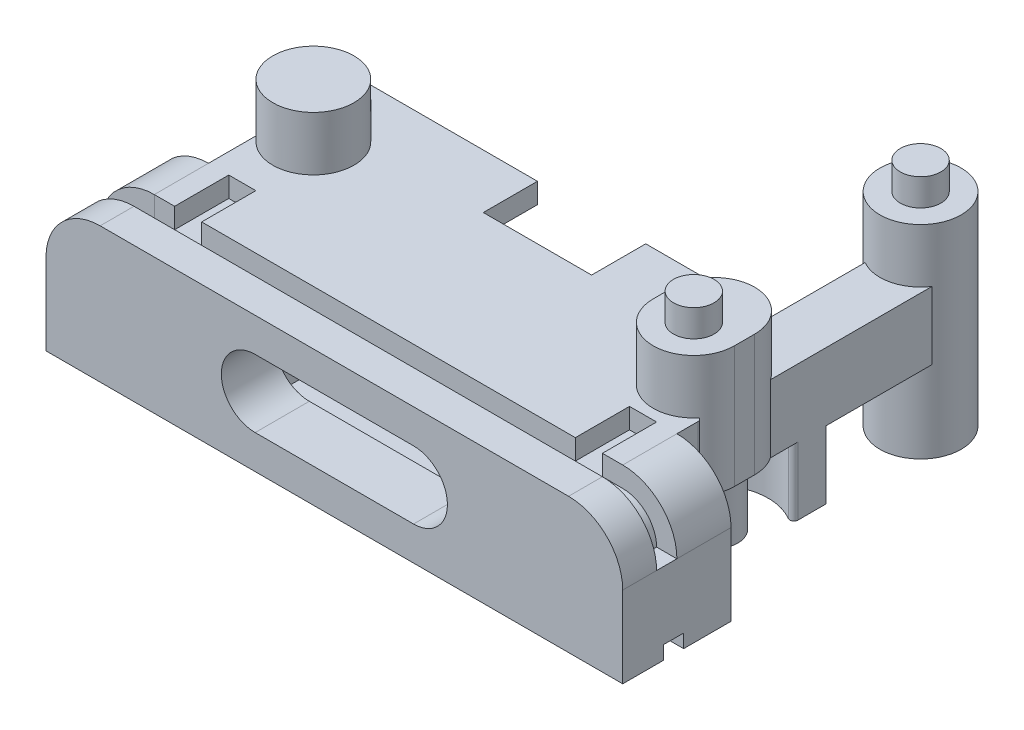
from build123d import *

# Parameters (mm, degrees)
SKETCH1_W                    = 21.3
SKETCH1_H                    = 4
FRONT_DEPTH                  = 5
FRONT_FILLET_R               = 2
TYPE_C_DEPTH                 = 4
TYPE_C_INSIDE_FILET_R        = 0.1
SKETCH15_W                   = 2
SKETCH15_H                   = 2.5
LEFT_BODY_DEPTH              = 9.65
SKETCH16_W                   = 2
SKETCH16_H                   = 2.5
RIGHT_BODY_DEPTH             = 5
SKETCH32_R                   = 1.5
POSTS_DEPTH                  = 2
POSTS_DIRECTION_2_REACH      = 25.913
SKETCH_44_W                  = 17.3
SKETCH_44_H                  = 5
BODY_DEPTH                   = 5.5
SKETCH56_R                   = 2
SKETCH56_R_2                 = 1.75
TOP_POSTS_CUT_DEPTH          = 2.5
SKETCH90_W                   = 6.623504636
SKETCH90_H                   = 1.75
TOP_SLOT_DEPTH               = 0.4
SKETCH37_R                   = 0.75
SKETCH37_R_2                 = 0.875
TOP_POSTS_DEPTH              = 2.5
SKETCH94_R                   = 1.5
TOP_POSTS_BACK_DEPTH         = 3
SKETCH38_R                   = 0.75
BOTTOM_POSTS_DEPTH           = 1
PCB_DEPTH                    = 2
PCB_DEPTH_BACK               = 5.5
SKETCH43_W                   = 10
SKETCH43_H                   = 0.9
SKETCH91_W                   = 8.5
SKETCH91_H                   = 1.3
PCB_TOP_BOTTOM_DEPTH         = 7.5
PCB_TOP_BOTTOM_FILLET_R      = 0.25
SKETCH95_W                   = 4
SKETCH95_H                   = 2
LATCH_DEPTH                  = 0.75
SKETCH83_W                   = 0.75
SKETCH83_H                   = 0.5
SKETCH89_W                   = 0.5
SKETCH89_H                   = 0.75
SKETCH86_W                   = 0.5
SKETCH86_H                   = 0.75
SKETCH75_W                   = 0.75
SKETCH75_H                   = 0.75
SKETCH93_W                   = 1
SKETCH93_H                   = 0.75
BOTTOM_GROOVE_SUPPORTS_DEPTH = 2
WALL_START                   = -1
WALL_THICKNESS_DEPTH         = 3.5
WALL_START_2                 = 1.5137
WALL_THICKNESS_2_DEPTH       = 4.4863
WALL_THICKNESS_3_DEPTH       = 1.5


with BuildPart() as part:
    # Sketch1 → Front (new body)
    with BuildSketch(Plane(origin=(0, 0, 0), x_dir=(1, 0, 0), z_dir=(0, 1, 0))):
        with Locations((10.65, -2)):
            Rectangle(SKETCH1_W, SKETCH1_H)
    extrude(amount=FRONT_DEPTH)

    # Front Fillet
    front_fillet_edges = [part.edges().sort_by_distance(p)[0] for p in [
        (0, 5, 2),
        (21.3, 5, 2),
    ]]
    fillet(front_fillet_edges, radius=FRONT_FILLET_R)

    # Sketch41 → Type-C (cut)
    with BuildSketch(Plane.XY.offset(4)):
        with BuildLine():
            Line((7.725, 3.75), (13.575, 3.75))
            ThreePointArc((13.575, 3.75), (14.825, 2.5), (13.575, 1.25))
            Line((13.575, 1.25), (7.725, 1.25))
            ThreePointArc((7.725, 1.25), (6.475, 2.5), (7.725, 3.75))
        make_face()
    extrude(amount=-TYPE_C_DEPTH, mode=Mode.SUBTRACT)

    # Type-C Inside Filet
    type_c_inside_filet_edges = [part.edges().sort_by_distance(p)[0] for p in [
        (10.65, 1.25, 0),
        (14.825, 2.5, 0),
        (10.65, 3.75, 0),
        (6.475, 2.5, 0),
    ]]
    fillet(type_c_inside_filet_edges, radius=TYPE_C_INSIDE_FILET_R)

    # Sketch15 → Left Body (add)
    with BuildSketch(Plane(origin=(0, 0, 0), x_dir=(-1, 0, 0), z_dir=(0, 0, -1))):
        with Locations((-18.3, 3.75)):
            Rectangle(SKETCH15_W, SKETCH15_H)
    extrude(amount=LEFT_BODY_DEPTH)

    # Sketch16 → Right Body (add)
    with BuildSketch(Plane(origin=(0, 0, 0), x_dir=(-1, 0, 0), z_dir=(0, 0, -1))):
        with Locations((-3, 3.75)):
            Rectangle(SKETCH16_W, SKETCH16_H)
    extrude(amount=RIGHT_BODY_DEPTH)

    # Sketch32 → Posts (add)
    with BuildSketch(Plane(origin=(0, 5, 0), x_dir=(-1, 0, 0), z_dir=(0, -1, 0))):
        with Locations(Location((-18.05, 10.25, 0), (0, 0, 300))):
            Circle(SKETCH32_R)
        with Locations(Location((-3.25, 2.625, 0), (0, 0, 240))):
            Circle(SKETCH32_R)
        with BuildLine():
            Line((-16.55, 2.625), (-16.55, 1.875))
            ThreePointArc((-16.55, 1.875), (-18.05, 0.375), (-19.55, 1.875))
            Line((-19.55, 1.875), (-19.55, 2.625))
            ThreePointArc((-19.55, 2.625), (-18.05, 4.125), (-16.55, 2.625))
        make_face()
    extrude(amount=-POSTS_DEPTH)

    # Posts direction 2: up to this face of the body (flat: up to its plane)
    posts_direction_2_end = Plane(part.part.faces().sort_by_distance((18.3, 2.5, -4.825))[0])
    # Sketch32 → Posts direction 2 (add, up to the picked face)
    with BuildSketch(Plane(origin=(0, 5, 0), x_dir=(-1, 0, 0), z_dir=(0, -1, 0)), mode=Mode.PRIVATE) as posts_direction_2_sk1:
        with Locations(Location((-18.05, 10.25, 0), (0, 0, 300))):
            Circle(SKETCH32_R)
    posts_direction_2_tool1 = split(extrude(posts_direction_2_sk1.sketch, amount=POSTS_DIRECTION_2_REACH, mode=Mode.PRIVATE), bisect_by=posts_direction_2_end, keep=Keep.BOTH, mode=Mode.PRIVATE)
    # Sketch32 → Posts direction 2 (add, up to the picked face)
    with BuildSketch(Plane(origin=(0, 5, 0), x_dir=(-1, 0, 0), z_dir=(0, -1, 0)), mode=Mode.PRIVATE) as posts_direction_2_sk2:
        with Locations(Location((-3.25, 2.625, 0), (0, 0, 240))):
            Circle(SKETCH32_R)
    posts_direction_2_tool2 = split(extrude(posts_direction_2_sk2.sketch, amount=POSTS_DIRECTION_2_REACH, mode=Mode.PRIVATE), bisect_by=posts_direction_2_end, keep=Keep.BOTH, mode=Mode.PRIVATE)
    # Sketch32 → Posts direction 2 (add, up to the picked face)
    with BuildSketch(Plane(origin=(0, 5, 0), x_dir=(-1, 0, 0), z_dir=(0, -1, 0)), mode=Mode.PRIVATE) as posts_direction_2_sk3:
        with BuildLine():
            Line((-16.55, 2.625), (-16.55, 1.875))
            ThreePointArc((-16.55, 1.875), (-18.05, 0.375), (-19.55, 1.875))
            Line((-19.55, 1.875), (-19.55, 2.625))
            ThreePointArc((-19.55, 2.625), (-18.05, 4.125), (-16.55, 2.625))
        make_face()
    posts_direction_2_tool3 = split(extrude(posts_direction_2_sk3.sketch, amount=POSTS_DIRECTION_2_REACH, mode=Mode.PRIVATE), bisect_by=posts_direction_2_end, keep=Keep.BOTH, mode=Mode.PRIVATE)
    add(posts_direction_2_tool1.solids().sort_by(Axis((18.05, 5, -10.25), (0, -1, 0)))[0])
    add(posts_direction_2_tool2.solids().sort_by(Axis((3.25, 5, -2.625), (0, -1, 0)))[0])
    add(posts_direction_2_tool3.solids().sort_by(Axis((18.05, 5, -2.25), (0, -1, 0)))[0])

    # Sketch 44 → Body (add)
    with BuildSketch(Plane.XY):
        with Locations((10.65, 2.5)):
            Rectangle(SKETCH_44_W, SKETCH_44_H)
    extrude(amount=-BODY_DEPTH)

    # Sketch56 → Top Posts Cut (cut)
    with BuildSketch(Plane(origin=(0, 2.5, 0), x_dir=(-1, 0, 0), z_dir=(0, -1, 0))):
        with Locations((-18.05, 2.625)):
            Circle(SKETCH56_R)
        with Locations((-3.25, 2.625)):
            Circle(SKETCH56_R)
        with Locations(Location((-18.05, -1.75, 0), (0, 0, 270))):
            Circle(SKETCH56_R_2)
        with Locations(Location((-3.25, -1.75, 0), (0, 0, 270))):
            Circle(SKETCH56_R_2)
    extrude(amount=TOP_POSTS_CUT_DEPTH, mode=Mode.SUBTRACT)

    # Sketch90 → Top Slot (cut)
    with BuildSketch(Plane.XZ):
        with Locations((10.65, -0.588209251)):
            Rectangle(SKETCH90_W, SKETCH90_H)
    extrude(amount=-TOP_SLOT_DEPTH, mode=Mode.SUBTRACT)

    # Sketch37 → Top Posts (add)
    with BuildSketch(Plane(origin=(0, 2.5, 0), x_dir=(-1, 0, 0), z_dir=(0, -1, 0))):
        with Locations(Location((-3.25, -1.75, 0), (0, 0, 270))):
            Circle(SKETCH37_R)
        with Locations(Location((-18.05, 2.625, 0), (0, 0, 270))):
            Circle(SKETCH37_R_2)
        with Locations(Location((-3.25, 2.625, 0), (0, 0, 270))):
            Circle(SKETCH37_R_2)
        with Locations(Location((-18.05, -1.75, 0), (0, 0, 270))):
            Circle(SKETCH37_R)
    extrude(amount=TOP_POSTS_DEPTH)

    # Sketch94 → Top Posts Back (add)
    with BuildSketch(Plane.XZ.offset(-2.5)):
        with Locations(Location((18.05, -10.25, 0), (0, 0, 90))):
            Circle(SKETCH94_R)
    extrude(amount=TOP_POSTS_BACK_DEPTH)

    # Sketch38 → Bottom Posts (add)
    with BuildSketch(Plane(origin=(0, 7, 0), x_dir=(1, 0, 0), z_dir=(0, 1, 0))):
        with Locations(Location((18.05, 10.25, 0), (0, 0, 270))):
            Circle(SKETCH38_R)
        with Locations(Location((18.05, 1.875, 0), (0, 0, 270))):
            Circle(SKETCH38_R)
    extrude(amount=BOTTOM_POSTS_DEPTH)

    # Sketch43 → PCB (cut, two sides: drawn at the far end of the back side and taken through both)
    with BuildSketch(Plane.XY.offset(-PCB_DEPTH_BACK)):
        with Locations((10.65, 2.5)):
            Rectangle(SKETCH43_W, SKETCH43_H)
    extrude(amount=PCB_DEPTH + PCB_DEPTH_BACK, mode=Mode.SUBTRACT)

    # Sketch91 → PCB Top/Bottom (cut)
    with BuildSketch(Plane(origin=(0, 0, 2), x_dir=(-1, 0, 0), z_dir=(0, 0, -1))):
        with Locations((-10.65, 1.45)):
            Rectangle(SKETCH91_W, SKETCH91_H)
        with Locations((-10.65, 3.6)):
            Rectangle(SKETCH91_W, SKETCH91_H)
    extrude(amount=PCB_TOP_BOTTOM_DEPTH, mode=Mode.SUBTRACT)

    # PCB Top/Bottom Fillet
    pcb_top_bottom_fillet_edges = [part.edges().sort_by_distance(p)[0] for p in [
        (10.65, 0.8, 2),
        (10.65, 4.25, 2),
    ]]
    fillet(pcb_top_bottom_fillet_edges, radius=PCB_TOP_BOTTOM_FILLET_R)

    # Sketch95 → Latch (cut)
    with BuildSketch(Plane(origin=(0, 5, 0), x_dir=(1, 0, 0), z_dir=(0, 1, 0))):
        with Locations((10.65, 4.5)):
            Rectangle(SKETCH95_W, SKETCH95_H)
    extrude(amount=-LATCH_DEPTH, mode=Mode.SUBTRACT)

    # Top Groove Middle: sweep along a curve in space
    with BuildLine() as top_groove_middle_path:
        Line((4.83113883, 0, 2.5), (16.46886117, 0, 2.5))
    # Sketch83 → Top Groove Middle (sweep, cut)
    with BuildSketch(Plane(origin=(4.83113883, 0, 2.5), x_dir=(0, 0, -1), z_dir=(1, 0, 0))):
        with Locations((0.375, 0.25)):
            Rectangle(SKETCH83_W, SKETCH83_H)
    sweep(path=top_groove_middle_path.line, mode=Mode.SUBTRACT)

    # Top Groove Left: sweep along a curve in space
    with BuildLine() as top_groove_left_path:
        Line((19.63113883, 0, 2.5), (21.3, 0, 2.5))
    # Sketch89 → Top Groove Left (sweep, cut)
    with BuildSketch(Plane(origin=(21.3, 2, 1.7), x_dir=(0, 1, 0), z_dir=(-1, 0, 0))):
        with Locations((-1.75, -0.425)):
            Rectangle(SKETCH89_W, SKETCH89_H)
    sweep(path=top_groove_left_path.line, mode=Mode.SUBTRACT)

    # Top Groove Right: sweep along a curve in space
    with BuildLine() as top_groove_right_path:
        Line((0, 0, 2.5), (1.66886117, 0, 2.5))
    # Sketch86 → Top Groove Right (sweep, cut)
    with BuildSketch(Plane(origin=(0, 2, 1.7), x_dir=(0, -1, 0), z_dir=(1, 0, 0))):
        with Locations((1.75, -0.425)):
            Rectangle(SKETCH86_W, SKETCH86_H)
    sweep(path=top_groove_right_path.line, mode=Mode.SUBTRACT)

    # Bottom Groove: sweep along a curve in space
    with BuildLine() as bottom_groove_path:
        ThreePointArc((21.3, 3, 2.75), (20.714213562, 4.414213562, 2.75), (19.3, 5, 2.75))
        Line((19.3, 5, 2.75), (2, 5, 2.75))
        ThreePointArc((2, 5, 2.75), (0.585786438, 4.414213562, 2.75), (0, 3, 2.75))
    # Sketch75 → Bottom Groove (sweep, cut)
    with BuildSketch(Plane(origin=(19.3, 5, 4), x_dir=(0, 0, -1), z_dir=(1, 0, 0))):
        with Locations((1.625, -0.375)):
            Rectangle(SKETCH75_W, SKETCH75_H)
    sweep(path=bottom_groove_path.line, mode=Mode.SUBTRACT)

    # Sketch93 → Bottom Groove Supports (cut)
    with BuildSketch(Plane.XY.offset(2)):
        with Locations((18.05, 4.625)):
            Rectangle(SKETCH93_W, SKETCH93_H)
        with Locations((3.25, 4.625)):
            Rectangle(SKETCH93_W, SKETCH93_H)
    extrude(amount=-BOTTOM_GROOVE_SUPPORTS_DEPTH, mode=Mode.SUBTRACT)

    # Wall Thickness: read off the stored shape, not the designer's step
    # Wall Thickness outline → Wall Thickness (cut)
    with BuildSketch(Plane(origin=(0, 0, 0), x_dir=(1, 0, 0), z_dir=(0, 1, 0)).offset(WALL_START)):
        with BuildLine():
            ThreePointArc((19.3, 4.47229532), (19.224122777, 4.341888978), (19.073255814, 4.343414251))
            ThreePointArc((19.073255814, 4.343414251), (19.189341121, 4.268746274), (19.3, 4.1862495))
            Line((19.3, 4.1862495), (19.3, 4.47229532))
        make_face()
        with BuildLine():
            Line((19.3, 0.77770468), (19.3, 1.0637505))
            ThreePointArc((19.3, 1.0637505), (19.189341121, 0.981253726), (19.073255814, 0.906585749))
            ThreePointArc((19.073255814, 0.906585749), (19.224122777, 0.908111022), (19.3, 0.77770468))
        make_face()
        with BuildLine():
            ThreePointArc((2, 0.77770468), (2.075877223, 0.908111022), (2.226744186, 0.906585749))
            ThreePointArc((2.226744186, 0.906585749), (2.110658879, 0.981253726), (2, 1.0637505))
            Line((2, 1.0637505), (2, 0.77770468))
        make_face()
        with BuildLine():
            ThreePointArc((2, 4.1862495), (2.110658879, 4.268746274), (2.226744186, 4.343414251))
            ThreePointArc((2.226744186, 4.343414251), (2.075877223, 4.341888978), (2, 4.47229532))
            Line((2, 4.47229532), (2, 4.1862495))
        make_face()
    extrude(amount=WALL_THICKNESS_DEPTH, mode=Mode.SUBTRACT)

    # Wall Thickness 2 outline → Wall Thickness 2 (cut)
    with BuildSketch(Plane(origin=(0, 0, 0), x_dir=(1, 0, 0), z_dir=(0, 1, 0)).offset(WALL_START_2)):
        with BuildLine():
            ThreePointArc((19.204576743, 0.917423609), (19.273867896, 0.862302223), (19.3, 0.77770468))
            Line((19.3, 0.77770468), (19.3, 1.045843802))
            ThreePointArc((19.3, 1.045843802), (19.254001771, 0.980360556), (19.204576743, 0.917423609))
        make_face()
    extrude(amount=WALL_THICKNESS_2_DEPTH, mode=Mode.SUBTRACT)

    # Wall Thickness 3 outline → Wall Thickness 3 (cut)
    with BuildSketch(Plane(origin=(0, 0, 0), x_dir=(1, 0, 0), z_dir=(0, 1, 0)).offset(WALL_START)):
        with BuildLine():
            ThreePointArc((1.576679947, -2.5), (1.653628323, -2.521240739), (1.708784162, -2.578947368))
            ThreePointArc((1.708784162, -2.578947368), (1.688323708, -2.539726003), (1.66886117, -2.5))
            Line((1.66886117, -2.5), (1.576679947, -2.5))
        make_face()
        with BuildLine():
            ThreePointArc((4.83113883, -2.5), (4.811676292, -2.539726003), (4.791215838, -2.578947368))
            ThreePointArc((4.791215838, -2.578947368), (4.846371677, -2.521240739), (4.923320053, -2.5))
            Line((4.923320053, -2.5), (4.83113883, -2.5))
        make_face()
        with BuildLine():
            Line((1.355930308, -1.75), (1.5, -1.75))
            ThreePointArc((1.5, -1.75), (1.501366065, -1.680867087), (1.505462125, -1.611842105))
            ThreePointArc((1.505462125, -1.611842105), (1.457723441, -1.710173308), (1.355930308, -1.75))
        make_face()
        with BuildLine():
            Line((16.46886117, -2.5), (16.376679947, -2.5))
            ThreePointArc((16.376679947, -2.5), (16.453628323, -2.521240739), (16.508784162, -2.578947368))
            ThreePointArc((16.508784162, -2.578947368), (16.488323708, -2.539726003), (16.46886117, -2.5))
        make_face()
        with BuildLine():
            ThreePointArc((4.994537875, -1.611842105), (4.998633935, -1.680867087), (5, -1.75))
            Line((5, -1.75), (5.144069692, -1.75))
            ThreePointArc((5.144069692, -1.75), (5.042276559, -1.710173308), (4.994537875, -1.611842105))
        make_face()
        with BuildLine():
            ThreePointArc((19.63113883, -2.5), (19.611676292, -2.539726003), (19.591215838, -2.578947368))
            ThreePointArc((19.591215838, -2.578947368), (19.646371677, -2.521240739), (19.723320053, -2.5))
            Line((19.723320053, -2.5), (19.63113883, -2.5))
        make_face()
        with BuildLine():
            Line((16.155930308, -1.75), (16.3, -1.75))
            ThreePointArc((16.3, -1.75), (16.301366065, -1.680867087), (16.305462125, -1.611842105))
            ThreePointArc((16.305462125, -1.611842105), (16.257723441, -1.710173308), (16.155930308, -1.75))
        make_face()
        with BuildLine():
            ThreePointArc((19.794537875, -1.611842105), (19.798633935, -1.680867087), (19.8, -1.75))
            Line((19.8, -1.75), (19.944069692, -1.75))
            ThreePointArc((19.944069692, -1.75), (19.842276559, -1.710173308), (19.794537875, -1.611842105))
        make_face()
    extrude(amount=WALL_THICKNESS_3_DEPTH, mode=Mode.SUBTRACT)


solid = part.part
